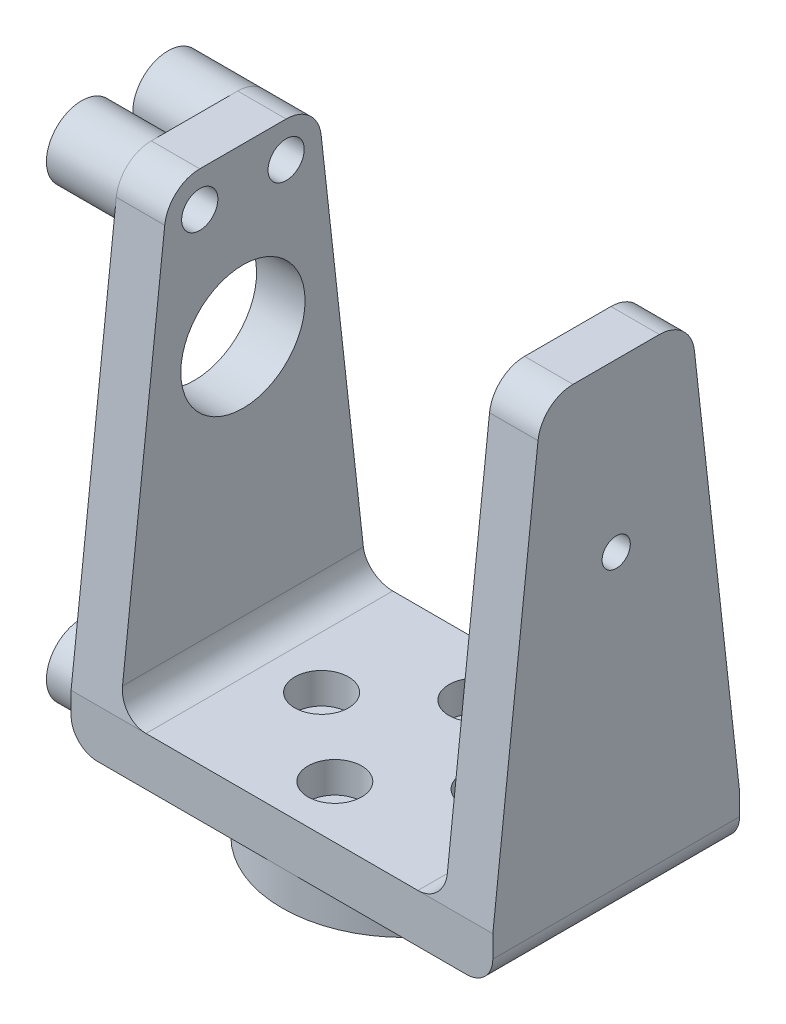
from build123d import *

# Parameters (mm, degrees)
GIMBAL_MOUNT_BODY_DEPTH        = 28
SKETCH7_R                      = 7.05
SERVO_GEAR_MOUND_CUT_OUT_DEPTH = 5.5
BOSS_EXTRUDE6_DEPTH            = 5.5
BOSS_EXTRUDE7_START            = 7.9
SKETCH15_R                     = 4
BOSS_EXTRUDE7_DEPTH            = 7.9
SKETCH17_R                     = 1.6
CUT_EXTRUDE2_DEPTH             = 5.5
SKETCH19_R                     = 14
BOSS_EXTRUDE9_DEPTH            = 3.94
SKETCH20_R                     = 1.75
CUT_EXTRUDE4_DEPTH             = 9.44
SKETCH21_R                     = 2.055
CUT_EXTRUDE5_DEPTH             = 13.4
SKETCH30_R                     = 2.3
SKETCH30_R_2                   = 1.6
BOSS_EXTRUDE10_DEPTH           = 0.5
CUT_EXTRUDE11_DEPTH            = 82.696849282
SKETCH29_R                     = 3.05
CUT_EXTRUDE12_DEPTH            = 3.5
CUT_EXTRUDE7_DEPTH             = 82.696849282
FILLET4_R                      = 3
FILLET5_R                      = 4


# Some blends are built 0.0001 mm under size
with BuildPart() as part:
    # Sketch6 → Gimbal Mount Body (new body)
    with BuildSketch(Plane.XY):
        Polygon((0, 0), (-14, 0), (-23.928932188, 0), (-23.928932188, 9.928932188), (-23.928932188, 60), (-18.428932188, 60), (-18.428932188, 12), (-18.428932188, 5.5), (-11.928932188, 5.5), (0, 5.5), align=None)
    gimbal_mount_body = extrude(amount=-GIMBAL_MOUNT_BODY_DEPTH)

    # Gimbal Mount Body Mirror: Gimbal Mount Body across plane
    add(gimbal_mount_body.mirror(Plane(origin=(0, 0, 0), x_dir=(0, 0, 1), z_dir=(1, 0, 0))))

    # Sketch7 → Servo Gear Mound Cut Out (cut)
    with BuildSketch(Plane.ZY.offset(23.928932188)):
        with Locations(Location((-14, 36, 0), (0, 0, 270))):
            Circle(SKETCH7_R)
    extrude(amount=-SERVO_GEAR_MOUND_CUT_OUT_DEPTH, mode=Mode.SUBTRACT)

    # Sketch14 → Boss-Extrude6 (add)
    with BuildSketch(Plane.ZY.offset(23.928932188)):
        with BuildLine():
            Line((-18.9, -3.94), (-9.1, -3.94))
            ThreePointArc((-9.1, -3.94), (-6.29286623, -2.78956137), (-5.100450025, 0))
            Line((-5.100450025, 0), (-22.899549975, 0))
            ThreePointArc((-22.899549975, 0), (-21.70713377, -2.78956137), (-18.9, -3.94))
        make_face()
    extrude(amount=-BOSS_EXTRUDE6_DEPTH)

    # Sketch15 → Boss-Extrude7 (add)
    with BuildSketch(Plane.ZY.offset(23.928932188).offset(BOSS_EXTRUDE7_START)):
        with Locations((-18.9, 50.94)):
            Circle(SKETCH15_R)
        with Locations((-9.1, 50.94)):
            Circle(SKETCH15_R)
        with Locations((-18.9, 0.06)):
            Circle(SKETCH15_R)
        with Locations((-9.1, 0.06)):
            Circle(SKETCH15_R)
    extrude(amount=-BOSS_EXTRUDE7_DEPTH)

    # Sketch17 → Cut-Extrude2 (cut)
    with BuildSketch(Plane(origin=(23.928932188, 0, 0), x_dir=(0, 0, -1), z_dir=(1, 0, 0))):
        with Locations((14, 36)):
            Circle(SKETCH17_R)
    extrude(amount=-CUT_EXTRUDE2_DEPTH, mode=Mode.SUBTRACT)

    # Sketch19 → Boss-Extrude9 (add)
    with BuildSketch(Plane.XZ):
        with Locations(Location((0, -14, 0), (0, 0, 270))):
            Circle(SKETCH19_R)
    extrude(amount=BOSS_EXTRUDE9_DEPTH)

    # Sketch20 → Cut-Extrude4 (cut)
    with BuildSketch(Plane.XZ.offset(3.94)):
        with Locations(Location((0, -6, 0), (0, 0, 270))):
            Circle(SKETCH20_R)
        with Locations(Location((-9.5, -14, 0), (0, 0, 270))):
            Circle(SKETCH20_R)
        with Locations(Location((9.5, -14, 0), (0, 0, 270))):
            Circle(SKETCH20_R)
        with Locations(Location((0, -22, 0), (0, 0, 270))):
            Circle(SKETCH20_R)
    extrude(amount=-CUT_EXTRUDE4_DEPTH, mode=Mode.SUBTRACT)

    # Sketch21 → Cut-Extrude5 (cut)
    with BuildSketch(Plane.ZY.offset(31.828932188)):
        with Locations((-18.9, 50.94)):
            Circle(SKETCH21_R)
        with Locations((-9.1, 50.94)):
            Circle(SKETCH21_R)
        with Locations((-9.1, 0.06)):
            Circle(SKETCH21_R)
        with Locations((-18.9, 0.06)):
            Circle(SKETCH21_R)
    extrude(amount=-CUT_EXTRUDE5_DEPTH, mode=Mode.SUBTRACT)

    # Sketch30 → Boss-Extrude10 (add)
    with BuildSketch(Plane.ZY.offset(-18.428932188)):
        with Locations(Location((-14, 36, 0), (0, 0, 180))):
            Circle(SKETCH30_R)
        with Locations(Location((-14, 36, 0), (0, 0, 180))):
            Circle(SKETCH30_R_2, mode=Mode.SUBTRACT)
    extrude(amount=BOSS_EXTRUDE10_DEPTH)

    # Sketch28 → Cut-Extrude11 (cut, through all)
    with BuildSketch(Plane.ZY.offset(23.928932188)):
        Polygon((0, 5.5), (-6.087027099, 60), (0, 60), align=None)
        Polygon((-28, 5.5), (-21.912972901, 60), (-28, 60), align=None)
    extrude(amount=-CUT_EXTRUDE11_DEPTH, mode=Mode.SUBTRACT)

    # Sketch29 → Cut-Extrude12 (cut)
    with BuildSketch(Plane(origin=(0, 5.5, 0), x_dir=(1, 0, 0), z_dir=(0, 1, 0))):
        with Locations(Location((0, 22, 0), (0, 0, 270))):
            Circle(SKETCH29_R)
        with Locations(Location((-9.5, 14, 0), (0, 0, 270))):
            Circle(SKETCH29_R)
        with Locations(Location((0, 6, 0), (0, 0, 270))):
            Circle(SKETCH29_R)
        with Locations(Location((9.5, 14, 0), (0, 0, 270))):
            Circle(SKETCH29_R)
    extrude(amount=-CUT_EXTRUDE12_DEPTH, mode=Mode.SUBTRACT)

    # Sketch23 → Cut-Extrude7 (cut, through all)
    with BuildSketch(Plane.ZY.offset(23.928932188)):
        Polygon((-21.912972901, 60), (-6.087027099, 60), (-5.521882932, 54.94), (-22.478117068, 54.94), align=None)
    extrude(amount=-CUT_EXTRUDE7_DEPTH, mode=Mode.SUBTRACT)

    # Fillet4
    # the kernel refuses this fillet: 3 mm, written as the material it adds along each edge
    with BuildSketch(Plane(origin=(-18.428932188, 5.5, 0), x_dir=(1, 0, 0), z_dir=(0, 0, -1))) as fillet4_piece_1_section:
        with BuildLine():
            CenterArc((FILLET4_R, -FILLET4_R), FILLET4_R, 90, 90)
            Line((0, -FILLET4_R), (-FILLET4_R * 0.02, -FILLET4_R))
            Line((-FILLET4_R * 0.02, -FILLET4_R), (-FILLET4_R * 0.02, FILLET4_R * 0.02))
            Line((-FILLET4_R * 0.02, FILLET4_R * 0.02), (FILLET4_R, FILLET4_R * 0.02))
            Line((FILLET4_R, FILLET4_R * 0.02), (FILLET4_R, 0))
        make_face()
    fillet4_piece_1 = extrude(amount=28, mode=Mode.PRIVATE)
    fillet4_piece_1 = split(fillet4_piece_1, bisect_by=Plane(origin=(-17.747779905, 7.711892033, -27.75295694), z_dir=(0, -0.11099840059468292, 0.9938205849475158)), keep=Keep.TOP, mode=Mode.PRIVATE)
    fillet4_piece_1 = split(fillet4_piece_1, bisect_by=Plane(origin=(-17.747779905, 7.711892033, -0.24704306), z_dir=(0, -0.11099840059468276, -0.9938205849475158)), keep=Keep.TOP, mode=Mode.PRIVATE)
    add(fillet4_piece_1)
    with BuildSketch(Plane(origin=(18.428932188, 5.5, 0), x_dir=(-1, 0, 0), z_dir=(0, 0, -1))) as fillet4_piece_2_section:
        with BuildLine():
            CenterArc((FILLET4_R, FILLET4_R), FILLET4_R, 180, 90)
            Line((0, FILLET4_R), (-FILLET4_R * 0.02, FILLET4_R))
            Line((-FILLET4_R * 0.02, FILLET4_R), (-FILLET4_R * 0.02, -FILLET4_R * 0.02))
            Line((-FILLET4_R * 0.02, -FILLET4_R * 0.02), (FILLET4_R, -FILLET4_R * 0.02))
            Line((FILLET4_R, -FILLET4_R * 0.02), (FILLET4_R, 0))
        make_face()
    fillet4_piece_2 = extrude(amount=28, mode=Mode.PRIVATE)
    fillet4_piece_2 = split(fillet4_piece_2, bisect_by=Plane(origin=(17.747779905, 7.711892033, -27.75295694), z_dir=(0, -0.11099840059468292, 0.9938205849475158)), keep=Keep.TOP, mode=Mode.PRIVATE)
    fillet4_piece_2 = split(fillet4_piece_2, bisect_by=Plane(origin=(17.747779905, 7.711892033, -0.24704306), z_dir=(0, -0.11099840059468276, -0.9938205849475158)), keep=Keep.TOP, mode=Mode.PRIVATE)
    add(fillet4_piece_2)
    # the kernel refuses this fillet: 3 mm, written as the material it takes off along each edge
    with BuildSketch(Plane(origin=(-23.928932188, 0, -19.899549975), x_dir=(1, 0, 0), z_dir=(0, 0, -1))) as fillet4_2_piece_1_section:
        with BuildLine():
            CenterArc((FILLET4_R, -FILLET4_R), FILLET4_R, 90, 90)
            Line((0, -FILLET4_R), (-FILLET4_R * 0.02, -FILLET4_R))
            Line((-FILLET4_R * 0.02, -FILLET4_R), (-FILLET4_R * 0.02, FILLET4_R * 0.02))
            Line((-FILLET4_R * 0.02, FILLET4_R * 0.02), (FILLET4_R, FILLET4_R * 0.02))
            Line((FILLET4_R, FILLET4_R * 0.02), (FILLET4_R, 0))
        make_face()
    fillet4_2_piece_1 = extrude(amount=11.100450025, mode=Mode.PRIVATE)
    fillet4_2_piece_1 = fillet4_2_piece_1 - Plane(origin=(-23.256393846, 0.06, -18.9), x_dir=(0, -0.014999999999998508, -0.999887493671163), z_dir=(-1, 0, 0)) * Cylinder(4, 35, mode=Mode.PRIVATE)
    add(fillet4_2_piece_1, mode=Mode.SUBTRACT)
    with BuildSketch(Plane(origin=(23.928932188, 0, 3), x_dir=(0, 1, 0), z_dir=(0, 0, -1))) as fillet4_2_piece_2:
        with BuildLine():
            CenterArc((FILLET4_R, -FILLET4_R), FILLET4_R, 90, 90)
            Line((0, -FILLET4_R), (-FILLET4_R * 0.02, -FILLET4_R))
            Line((-FILLET4_R * 0.02, -FILLET4_R), (-FILLET4_R * 0.02, FILLET4_R * 0.02))
            Line((-FILLET4_R * 0.02, FILLET4_R * 0.02), (FILLET4_R, FILLET4_R * 0.02))
            Line((FILLET4_R, FILLET4_R * 0.02), (FILLET4_R, 0))
        make_face()
    extrude(amount=34, mode=Mode.SUBTRACT)
    with BuildSketch(Plane(origin=(-23.928932188, 0, 3), x_dir=(1, 0, 0), z_dir=(0, 0, -1))) as fillet4_2_piece_3_section:
        with BuildLine():
            CenterArc((FILLET4_R, -FILLET4_R), FILLET4_R, 90, 90)
            Line((0, -FILLET4_R), (-FILLET4_R * 0.02, -FILLET4_R))
            Line((-FILLET4_R * 0.02, -FILLET4_R), (-FILLET4_R * 0.02, FILLET4_R * 0.02))
            Line((-FILLET4_R * 0.02, FILLET4_R * 0.02), (FILLET4_R, FILLET4_R * 0.02))
            Line((FILLET4_R, FILLET4_R * 0.02), (FILLET4_R, 0))
        make_face()
    fillet4_2_piece_3 = extrude(amount=11.100450025, mode=Mode.PRIVATE)
    fillet4_2_piece_3 = fillet4_2_piece_3 - Plane(origin=(-23.256393341, 0.06, -9.1), x_dir=(0, -1, 0), z_dir=(-1, 0, 0)) * Cylinder(4, 35, mode=Mode.PRIVATE)
    add(fillet4_2_piece_3, mode=Mode.SUBTRACT)

    # Fillet5
    fillet5_edges = [part.edges().sort_by_distance(p)[0] for p in [
        (21.178932188, 54.94, -5.521882932),
        (21.178932188, 54.94, -22.478117068),
        (-21.178932188, 54.94, -22.478117068),
        (-21.178932188, 54.94, -5.521882932),
    ]]
    fillet(fillet5_edges, radius=FILLET5_R - 0.0001)  # a hair under: the kernel refuses the full size


solid = part.part
